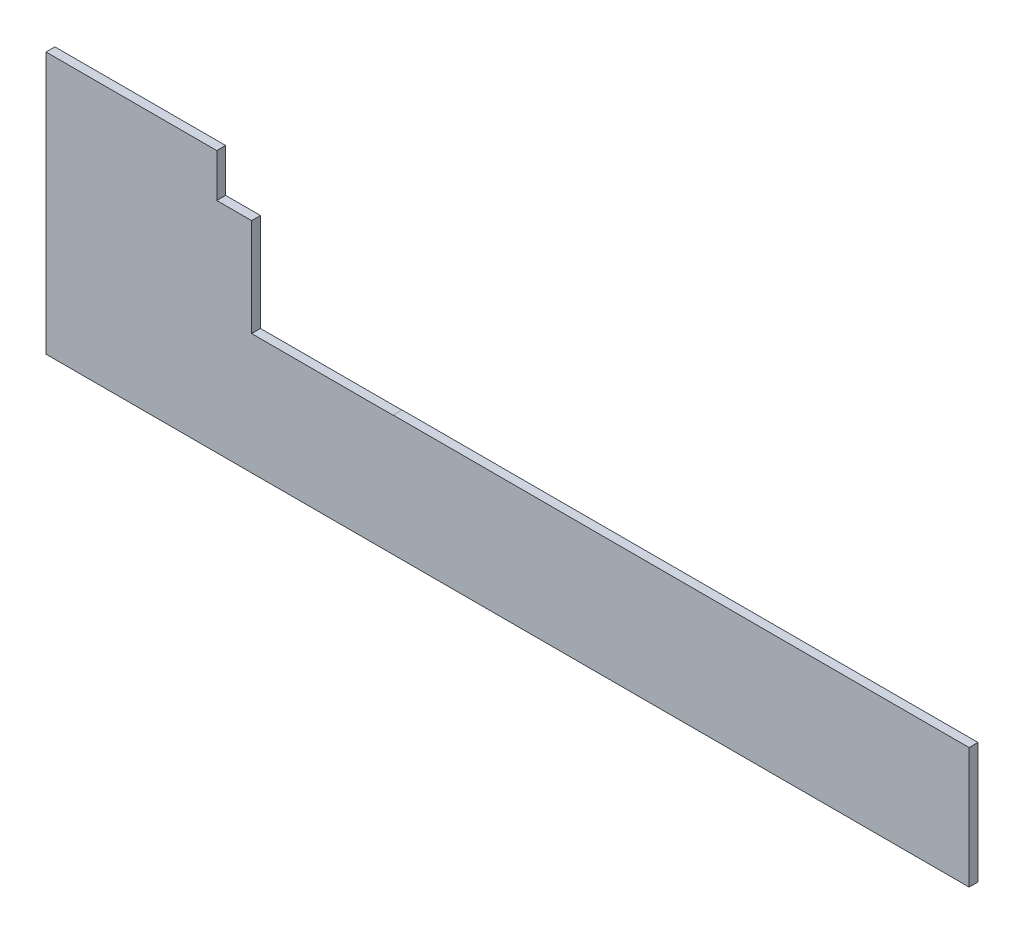
from build123d import *

# Parameters (mm, degrees)
TABAN_FLAN_1_DEPTH          = 40
KES_EKSTR_ZYON1_DEPTH       = 6196.554858122
KES_EKSTR_ZYON1_DEPTH_BACK  = 6196.554858122
IZIM6_W                     = 472
IZIM6_H                     = 278
IZIM7_W                     = 6002
IZIM7_H                     = 9
SEKME1_DEPTH                = 40
KES_EKSTR_ZYON2_DEPTH       = 6196.554858122
KES_EKSTR_ZYON2_DEPTH_BACK  = 6196.554858122
IZIM8_W                     = 475
IZIM8_H                     = 280
KES_EKSTR_ZYON3_DEPTH       = 6196.554858122
KES_EKSTR_ZYON3_DEPTH_BACK  = 6196.554858122
IZIM10_W                    = 475
IZIM10_H                    = 50
KES_EKSTR_ZYON4_DEPTH       = 6196.554858122
KES_EKSTR_ZYON4_DEPTH_BACK  = 6196.554858122
KES_EKSTR_ZYON5_DEPTH       = 5516.351756688
KES_EKSTR_ZYON5_DEPTH_BACK  = 5516.351756688
IZIM12_W                    = 1305
IZIM12_H                    = 635
KES_EKSTR_ZYON6_DEPTH       = 5516.351756688
KES_EKSTR_ZYON6_DEPTH_BACK  = 5516.351756688
IZIM13_W                    = 1515
IZIM13_H                    = 635
KES_EKSTR_ZYON7_DEPTH       = 5516.351756688
KES_EKSTR_ZYON7_DEPTH_BACK  = 5516.351756688
KES_EKSTR_ZYON8_DEPTH       = 5045.692359302
KES_EKSTR_ZYON8_DEPTH_BACK  = 5045.692359302
IZIM15_W                    = 437
IZIM15_H                    = 635
KES_EKSTR_ZYON9_DEPTH       = 5045.692359302
KES_EKSTR_ZYON9_DEPTH_BACK  = 5045.692359302
IZIM16_W                    = 795
IZIM16_H                    = 195
IZIM16_W_2                  = 168
IZIM16_H_2                  = 545
KES_EKSTR_ZYON10_DEPTH      = 4885.942681342
KES_EKSTR_ZYON10_DEPTH_BACK = 4885.942681342
IZIM17_W                    = 638
IZIM17_H                    = 441


# Sheet-metal steps are written as plain solids
with BuildPart() as part:
    # Çizim1 → Taban-Flanş1 (new body)
    with BuildSketch(Plane.XY):
        Polygon((0, 0), (0, -964), (472, -964), (472, -1536), (6002, -1536), (6002, 0), align=None)
    extrude(amount=-TABAN_FLAN_1_DEPTH)

    # Çizim6 → Kes-Ekstrüzyon1 (cut, two sides: drawn at the far end of the back side and taken through both)
    with BuildSketch(Plane.XY.offset(-KES_EKSTR_ZYON1_DEPTH_BACK)):
        with Locations((236, -825)):
            Rectangle(IZIM6_W, IZIM6_H)
        Polygon((472, -686), (472, -964), (472, -1536), (475, -1536), (475, -686), align=None)
    extrude(amount=KES_EKSTR_ZYON1_DEPTH + KES_EKSTR_ZYON1_DEPTH_BACK, mode=Mode.SUBTRACT)

    # Çizim7 → Sekme1 (add)
    with BuildSketch(Plane.XY):
        with Locations((3001, 4.5)):
            Rectangle(IZIM7_W, IZIM7_H)
    extrude(amount=-SEKME1_DEPTH)

    # Çizim8 → Kes-Ekstrüzyon2 (cut, two sides: drawn at the far end of the back side and taken through both)
    with BuildSketch(Plane.XY.offset(-KES_EKSTR_ZYON2_DEPTH_BACK)):
        with Locations((237.5, -546)):
            Rectangle(IZIM8_W, IZIM8_H)
    extrude(amount=KES_EKSTR_ZYON2_DEPTH + KES_EKSTR_ZYON2_DEPTH_BACK, mode=Mode.SUBTRACT)

    # Çizim10 → Kes-Ekstrüzyon3 (cut, two sides: drawn at the far end of the back side and taken through both)
    with BuildSketch(Plane.XY.offset(-KES_EKSTR_ZYON3_DEPTH_BACK)):
        Polygon((6002, -356), (6002, 9), (0, 9), (0, -356), (475, -356), align=None)
        with Locations((237.5, -381)):
            Rectangle(IZIM10_W, IZIM10_H)
    extrude(amount=KES_EKSTR_ZYON3_DEPTH + KES_EKSTR_ZYON3_DEPTH_BACK, mode=Mode.SUBTRACT)

    # Çizim11 → Kes-Ekstrüzyon4 (cut, two sides: drawn at the far end of the back side and taken through both)
    with BuildSketch(Plane.XY.offset(-KES_EKSTR_ZYON4_DEPTH_BACK)):
        Polygon((5297, -356), (5297, -1349), (5207, -1349), (5207, -1536), (6002, -1536), (6002, -356), align=None)
    extrude(amount=KES_EKSTR_ZYON4_DEPTH + KES_EKSTR_ZYON4_DEPTH_BACK, mode=Mode.SUBTRACT)

    # Çizim12 → Kes-Ekstrüzyon5 (cut, two sides: drawn at the far end of the back side and taken through both)
    with BuildSketch(Plane.XY.offset(-KES_EKSTR_ZYON5_DEPTH_BACK)):
        with Locations((4644.5, -673.5)):
            Rectangle(IZIM12_W, IZIM12_H)
    extrude(amount=KES_EKSTR_ZYON5_DEPTH + KES_EKSTR_ZYON5_DEPTH_BACK, mode=Mode.SUBTRACT)

    # Çizim13 → Kes-Ekstrüzyon6 (cut, two sides: drawn at the far end of the back side and taken through both)
    with BuildSketch(Plane.XY.offset(-KES_EKSTR_ZYON6_DEPTH_BACK)):
        with Locations((3234.5, -673.5)):
            Rectangle(IZIM13_W, IZIM13_H)
    extrude(amount=KES_EKSTR_ZYON6_DEPTH + KES_EKSTR_ZYON6_DEPTH_BACK, mode=Mode.SUBTRACT)

    # Çizim14 → Kes-Ekstrüzyon7 (cut, two sides: drawn at the far end of the back side and taken through both)
    with BuildSketch(Plane.XY.offset(-KES_EKSTR_ZYON7_DEPTH_BACK)):
        Polygon((4805, -991), (4805, -1536), (5297, -1547.167726618), (5297, -991), align=None)
    extrude(amount=KES_EKSTR_ZYON7_DEPTH + KES_EKSTR_ZYON7_DEPTH_BACK, mode=Mode.SUBTRACT)

    # Çizim15 → Kes-Ekstrüzyon8 (cut, two sides: drawn at the far end of the back side and taken through both)
    with BuildSketch(Plane.XY.offset(-KES_EKSTR_ZYON8_DEPTH_BACK)):
        with Locations((2258.5, -673.5)):
            Rectangle(IZIM15_W, IZIM15_H)
    extrude(amount=KES_EKSTR_ZYON8_DEPTH + KES_EKSTR_ZYON8_DEPTH_BACK, mode=Mode.SUBTRACT)

    # Çizim16 → Kes-Ekstrüzyon9 (cut, two sides: drawn at the far end of the back side and taken through both)
    with BuildSketch(Plane.XY.offset(-KES_EKSTR_ZYON9_DEPTH_BACK)):
        with Locations((1642.5, -453.5)):
            Rectangle(IZIM16_W, IZIM16_H)
        with Locations((4721, -1263.5)):
            Rectangle(IZIM16_W_2, IZIM16_H_2)
    extrude(amount=KES_EKSTR_ZYON9_DEPTH + KES_EKSTR_ZYON9_DEPTH_BACK, mode=Mode.SUBTRACT)

    # Çizim17 → Kes-Ekstrüzyon10 (cut, two sides: drawn at the far end of the back side and taken through both)
    with BuildSketch(Plane.XY.offset(-KES_EKSTR_ZYON10_DEPTH_BACK)):
        with Locations((1721, -771.5)):
            Rectangle(IZIM17_W, IZIM17_H)
    extrude(amount=KES_EKSTR_ZYON10_DEPTH + KES_EKSTR_ZYON10_DEPTH_BACK, mode=Mode.SUBTRACT)


solid = part.part
